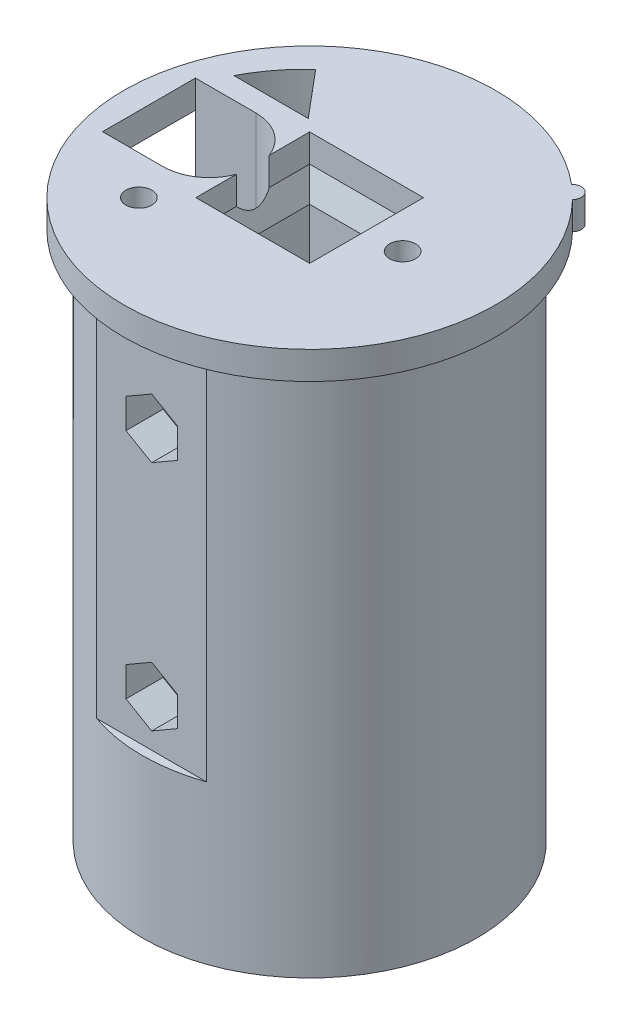
from build123d import *

# Parameters (mm, degrees)
SKETCH1_R           = 18
SKETCH1_R_2         = 2
SKETCH1_W           = 10.25
SKETCH1_H           = 10.25
BOSS_EXTRUDE1_DEPTH = 57
CUT_EXTRUDE1_START  = -7
CUT_EXTRUDE1_DEPTH  = 7
SKETCH4_W           = 9.35
SKETCH4_H           = 9.35
CUT_EXTRUDE3_DEPTH  = 20.4
CUT_EXTRUDE4_START  = -40
CUT_EXTRUDE4_DEPTH  = 40
SKETCH6_R           = 1.5
CUT_EXTRUDE5_DEPTH  = 70.267597042
SKETCH7_R           = 3
CUT_EXTRUDE6_DEPTH  = 3
CUT_EXTRUDE7_DEPTH  = 4
CHAMFER1_SIZE       = 1
CHAMFER1_SIZE_2     = 2.747477419
CUT_EXTRUDE8_DEPTH  = 63.42595614
SKETCH12_R          = 1.4
CUT_EXTRUDE10_DEPTH = 20
SKETCH13_R          = 20
SKETCH13_R_2        = 1.4
BOSS_EXTRUDE2_DEPTH = 3
BOSS_EXTRUDE3_DEPTH = 3


with BuildPart() as part:
    # Sketch1 → Boss-Extrude1 (new body)
    with BuildSketch(Plane(origin=(0, 0, 0), x_dir=(1, 0, 0), z_dir=(0, 1, 0))):
        with Locations(Location((0, 0, 0), (0, 0, 90))):
            Circle(SKETCH1_R)
        with Locations(Location((-12, 0, 0), (0, 0, 90))):
            Circle(SKETCH1_R_2, mode=Mode.SUBTRACT)
        Rectangle(SKETCH1_W, SKETCH1_H, mode=Mode.SUBTRACT)
    extrude(amount=BOSS_EXTRUDE1_DEPTH)

    # Sketch2 → Cut-Extrude1 (cut)
    with BuildSketch(Plane(origin=(0, 57, 0), x_dir=(1, 0, 0), z_dir=(0, 1, 0)).offset(CUT_EXTRUDE1_START)):
        with BuildLine():
            Line((-10.8, 5), (-17.291616466, 5))
            ThreePointArc((-17.291616466, 5), (-18, 0), (-17.291616466, -5))
            Line((-17.291616466, -5), (-10.8, -5))
            ThreePointArc((-10.8, -5), (-5.8, 0), (-10.8, 5))
        make_face()
    extrude(amount=CUT_EXTRUDE1_DEPTH, mode=Mode.SUBTRACT)

    # Sketch4 → Cut-Extrude3 (cut)
    with BuildSketch(Plane(origin=(0, 0, 0), x_dir=(-1, 0, 0), z_dir=(0, -1, 0))):
        with Locations((11.135393506, 0.872889968)):
            Rectangle(SKETCH4_W, SKETCH4_H)
    extrude(amount=-CUT_EXTRUDE3_DEPTH, mode=Mode.SUBTRACT)

    # Sketch5 → Cut-Extrude4 (cut)
    with BuildSketch(Plane(origin=(0, 57, 0), x_dir=(1, 0, 0), z_dir=(0, 1, 0)).offset(CUT_EXTRUDE4_START)):
        with BuildLine():
            Line((5.916079783, 17), (-5.916079783, 17))
            ThreePointArc((-5.916079783, 17), (0, 18), (5.916079783, 17))
        make_face()
        with BuildLine():
            Line((5.916079783, -17), (-5.916079783, -17))
            ThreePointArc((-5.916079783, -17), (0, -18), (5.916079783, -17))
        make_face()
    extrude(amount=CUT_EXTRUDE4_DEPTH, mode=Mode.SUBTRACT)

    # Sketch6 → Cut-Extrude5 (cut, through all)
    with BuildSketch(Plane(origin=(0, 0, -17), x_dir=(-1, 0, 0), z_dir=(0, 0, -1))):
        with Locations((0, 47)):
            Circle(SKETCH6_R)
        with Locations((0, 22)):
            Circle(SKETCH6_R)
    extrude(amount=-CUT_EXTRUDE5_DEPTH, mode=Mode.SUBTRACT)

    # Sketch7 → Cut-Extrude6 (cut)
    with BuildSketch(Plane(origin=(0, 0, -17), x_dir=(-1, 0, 0), z_dir=(0, 0, -1))):
        with Locations((0, 47)):
            Circle(SKETCH7_R)
        with Locations((0, 22)):
            Circle(SKETCH7_R)
    extrude(amount=-CUT_EXTRUDE6_DEPTH, mode=Mode.SUBTRACT)

    # Sketch8 → Cut-Extrude7 (cut)
    with BuildSketch(Plane.XY.offset(17)):
        Polygon((0, 43.8), (2.771281292, 45.4), (2.771281292, 48.6), (0, 50.2), (-2.771281292, 48.6), (-2.771281292, 45.4), align=None)
        Polygon((0, 18.8), (2.771281292, 20.4), (2.771281292, 23.6), (0, 25.2), (-2.771281292, 23.6), (-2.771281292, 20.4), align=None)
    extrude(amount=-CUT_EXTRUDE7_DEPTH, mode=Mode.SUBTRACT)

    # Chamfer1
    # the kernel refuses this chamfer: 2.747477419, 1 mm, written as the material it takes off along each edge
    with BuildSketch(Plane(origin=(-5.125, 57, -5.125), x_dir=(0, 0.09904090225204956, -0.9950833631817488), z_dir=(1, 0, 0)), Plane(origin=(-5.125, 57, 5.125), x_dir=(-0.9950833631817488, 0.09904090225204956, 0), z_dir=(0, 0, -1)), Plane(origin=(5.125, 57, 5.125), x_dir=(0, 0.09904090225204956, 0.9950833631817488), z_dir=(-1, 0, 0)), Plane(origin=(5.125, 57, -5.125), x_dir=(0.9950833631817488, 0.09904090225204956, 0), z_dir=(0, 0, 1))) as chamfer1_piece_1:
        Polygon((CHAMFER1_SIZE * 0.995083363182, -CHAMFER1_SIZE * 0.099040902252), (-CHAMFER1_SIZE_2 * 0.0990409022684, -CHAMFER1_SIZE_2 * 0.995083363346), (0, 0), align=None)
    extrude(amount=10.25, mode=Mode.SUBTRACT)
    with BuildSketch(Plane(origin=(-5.125, 57, 5.125), x_dir=(-0.9950833631817488, 0.09904090225204956, 0), z_dir=(0, 0, -1))) as chamfer1_piece_2a_section:
        Polygon((CHAMFER1_SIZE * 0.995083363182, -CHAMFER1_SIZE * 0.099040902252), (-CHAMFER1_SIZE_2 * 0.0990409022684, -CHAMFER1_SIZE_2 * 0.995083363346), (0, 0), align=None)
    chamfer1_piece_2a = extrude(amount=17.377491449, mode=Mode.PRIVATE)
    chamfer1_piece_2a = split(chamfer1_piece_2a, bisect_by=Plane(origin=(-5.432505006, 56.059901151, -5.125), z_dir=(0, 0, -1)), keep=Keep.TOP, mode=Mode.PRIVATE)
    with BuildSketch(Plane(origin=(-12.252491449, 57, -5.125), x_dir=(0, 0.09904090225204956, -0.9950833631817488), z_dir=(1, 0, 0))) as chamfer1_piece_2b_section:
        Polygon((CHAMFER1_SIZE * 0.995083363182, -CHAMFER1_SIZE * 0.099040902252), (-CHAMFER1_SIZE_2 * 0.0990409022684, -CHAMFER1_SIZE_2 * 0.995083363346), (0, 0), align=None)
    chamfer1_piece_2b = extrude(amount=17.377491449, mode=Mode.PRIVATE)
    chamfer1_piece_2b = split(chamfer1_piece_2b, bisect_by=Plane(origin=(-5.125, 56.059901151, -5.432505006), z_dir=(-1, 0, 0)), keep=Keep.TOP, mode=Mode.PRIVATE)
    chamfer1_piece_2 = chamfer1_piece_2a & chamfer1_piece_2b
    add(chamfer1_piece_2, mode=Mode.SUBTRACT)
    with BuildSketch(Plane(origin=(5.125, 57, -12.252491449), x_dir=(0.9950833631817488, 0.09904090225204956, 0), z_dir=(0, 0, 1))) as chamfer1_piece_3a_section:
        Polygon((CHAMFER1_SIZE * 0.995083363182, -CHAMFER1_SIZE * 0.099040902252), (-CHAMFER1_SIZE_2 * 0.0990409022684, -CHAMFER1_SIZE_2 * 0.995083363346), (0, 0), align=None)
    chamfer1_piece_3a = extrude(amount=17.377491449, mode=Mode.PRIVATE)
    chamfer1_piece_3a = split(chamfer1_piece_3a, bisect_by=Plane(origin=(5.432505006, 56.059901151, -5.125), z_dir=(0, 0, -1)), keep=Keep.TOP, mode=Mode.PRIVATE)
    with BuildSketch(Plane(origin=(-5.125, 57, -5.125), x_dir=(0, 0.09904090225204956, -0.9950833631817488), z_dir=(1, 0, 0))) as chamfer1_piece_3b_section:
        Polygon((CHAMFER1_SIZE * 0.995083363182, -CHAMFER1_SIZE * 0.099040902252), (-CHAMFER1_SIZE_2 * 0.0990409022684, -CHAMFER1_SIZE_2 * 0.995083363346), (0, 0), align=None)
    chamfer1_piece_3b = extrude(amount=17.377491449, mode=Mode.PRIVATE)
    chamfer1_piece_3b = split(chamfer1_piece_3b, bisect_by=Plane(origin=(5.125, 56.059901151, -5.432505006), z_dir=(1, 0, 0)), keep=Keep.TOP, mode=Mode.PRIVATE)
    chamfer1_piece_3 = chamfer1_piece_3a & chamfer1_piece_3b
    add(chamfer1_piece_3, mode=Mode.SUBTRACT)
    with BuildSketch(Plane(origin=(5.125, 57, 5.125), x_dir=(0, 0.09904090225204956, 0.9950833631817488), z_dir=(-1, 0, 0))) as chamfer1_piece_4a_section:
        Polygon((CHAMFER1_SIZE * 0.995083363182, -CHAMFER1_SIZE * 0.099040902252), (-CHAMFER1_SIZE_2 * 0.0990409022684, -CHAMFER1_SIZE_2 * 0.995083363346), (0, 0), align=None)
    chamfer1_piece_4a = extrude(amount=17.377491449, mode=Mode.PRIVATE)
    chamfer1_piece_4a = split(chamfer1_piece_4a, bisect_by=Plane(origin=(-5.125, 56.059901151, 5.432505006), z_dir=(-1, 0, 0)), keep=Keep.TOP, mode=Mode.PRIVATE)
    with BuildSketch(Plane(origin=(-5.125, 57, 12.252491449), x_dir=(-0.9950833631817488, 0.09904090225204956, 0), z_dir=(0, 0, -1))) as chamfer1_piece_4b_section:
        Polygon((CHAMFER1_SIZE * 0.995083363182, -CHAMFER1_SIZE * 0.099040902252), (-CHAMFER1_SIZE_2 * 0.0990409022684, -CHAMFER1_SIZE_2 * 0.995083363346), (0, 0), align=None)
    chamfer1_piece_4b = extrude(amount=17.377491449, mode=Mode.PRIVATE)
    chamfer1_piece_4b = split(chamfer1_piece_4b, bisect_by=Plane(origin=(-5.432505006, 56.059901151, 5.125), z_dir=(0, 0, 1)), keep=Keep.TOP, mode=Mode.PRIVATE)
    chamfer1_piece_4 = chamfer1_piece_4a & chamfer1_piece_4b
    add(chamfer1_piece_4, mode=Mode.SUBTRACT)
    with BuildSketch(Plane(origin=(12.252491449, 57, 5.125), x_dir=(0, 0.09904090225204956, 0.9950833631817488), z_dir=(-1, 0, 0))) as chamfer1_piece_5a_section:
        Polygon((CHAMFER1_SIZE * 0.995083363182, -CHAMFER1_SIZE * 0.099040902252), (-CHAMFER1_SIZE_2 * 0.0990409022684, -CHAMFER1_SIZE_2 * 0.995083363346), (0, 0), align=None)
    chamfer1_piece_5a = extrude(amount=17.377491449, mode=Mode.PRIVATE)
    chamfer1_piece_5a = split(chamfer1_piece_5a, bisect_by=Plane(origin=(5.125, 56.059901151, 5.432505006), z_dir=(1, 0, 0)), keep=Keep.TOP, mode=Mode.PRIVATE)
    with BuildSketch(Plane(origin=(5.125, 57, -5.125), x_dir=(0.9950833631817488, 0.09904090225204956, 0), z_dir=(0, 0, 1))) as chamfer1_piece_5b_section:
        Polygon((CHAMFER1_SIZE * 0.995083363182, -CHAMFER1_SIZE * 0.099040902252), (-CHAMFER1_SIZE_2 * 0.0990409022684, -CHAMFER1_SIZE_2 * 0.995083363346), (0, 0), align=None)
    chamfer1_piece_5b = extrude(amount=17.377491449, mode=Mode.PRIVATE)
    chamfer1_piece_5b = split(chamfer1_piece_5b, bisect_by=Plane(origin=(5.432505006, 56.059901151, 5.125), z_dir=(0, 0, 1)), keep=Keep.TOP, mode=Mode.PRIVATE)
    chamfer1_piece_5 = chamfer1_piece_5a & chamfer1_piece_5b
    add(chamfer1_piece_5, mode=Mode.SUBTRACT)

    # Sketch9 → Cut-Extrude8 (cut, through all)
    with BuildSketch(Plane.XZ):
        with BuildLine():
            Line((-7.454203172, -7.297889968), (-15.454203172, -7.297889968))
            ThreePointArc((-15.454203172, -7.297889968), (-13.761984914, -9.955415688), (-11.632322635, -12.277178848))
            Line((-11.632322635, -12.277178848), (-7.454203172, -7.297889968))
        make_face()
    extrude(amount=-CUT_EXTRUDE8_DEPTH, mode=Mode.SUBTRACT)

    # Sketch12 → Cut-Extrude10 (cut)
    with BuildSketch(Plane(origin=(0, 57, 0), x_dir=(1, 0, 0), z_dir=(0, 1, 0))):
        with Locations(Location((10, 0, 0), (0, 0, 270))):
            Circle(SKETCH12_R)
        with Locations(Location((-9.192388155, -9.192388155, 0), (0, 0, 270))):
            Circle(SKETCH12_R)
    extrude(amount=-CUT_EXTRUDE10_DEPTH, mode=Mode.SUBTRACT)

    # Sketch13 → Boss-Extrude2 (add)
    with BuildSketch(Plane(origin=(0, 57, 0), x_dir=(1, 0, 0), z_dir=(0, 1, 0))):
        with Locations(Location((0, 0, 0), (0, 0, 270))):
            Circle(SKETCH13_R)
        with Locations(Location((10, 0, 0), (0, 0, 270))):
            Circle(SKETCH13_R_2, mode=Mode.SUBTRACT)
        with Locations(Location((-9.192388155, -9.192388155, 0), (0, 0, 270))):
            Circle(SKETCH13_R_2, mode=Mode.SUBTRACT)
        with BuildLine():
            Line((-10.8, 5), (-17.291616466, 5))
            Line((-17.291616466, 5), (-17.291616466, -5))
            Line((-17.291616466, -5), (-10.8, -5))
            ThreePointArc((-10.8, -5), (-7.959770503, -4.114984375), (-6.125, -1.773238563))
            Line((-6.125, -1.773238563), (-6.125, -6.125))
            Line((-6.125, -6.125), (6.125, -6.125))
            Line((6.125, -6.125), (6.125, 6.125))
            Line((6.125, 6.125), (-6.125, 6.125))
            Line((-6.125, 6.125), (-6.125, 1.773238563))
            ThreePointArc((-6.125, 1.773238563), (-7.959770503, 4.114984375), (-10.8, 5))
        make_face(mode=Mode.SUBTRACT)
        with BuildLine():
            Line((-7.454203172, 7.297889968), (-15.454203172, 7.297889968))
            ThreePointArc((-15.454203172, 7.297889968), (-13.761984914, 9.955415688), (-11.632322635, 12.277178848))
            Line((-11.632322635, 12.277178848), (-7.454203172, 7.297889968))
        make_face(mode=Mode.SUBTRACT)
    extrude(amount=BOSS_EXTRUDE2_DEPTH)

    # Sketch14 → Boss-Extrude3 (add)
    with BuildSketch(Plane(origin=(0, 60, 0), x_dir=(1, 0, 0), z_dir=(0, 1, 0))):
        with BuildLine():
            Line((12.855752194, 15.320888862), (14.321646009, 13.960317173))
            ThreePointArc((14.321646009, 13.960317173), (14.268984946, 15.373549926), (12.855752194, 15.320888862))
        make_face()
    extrude(amount=-BOSS_EXTRUDE3_DEPTH)


solid = part.part
